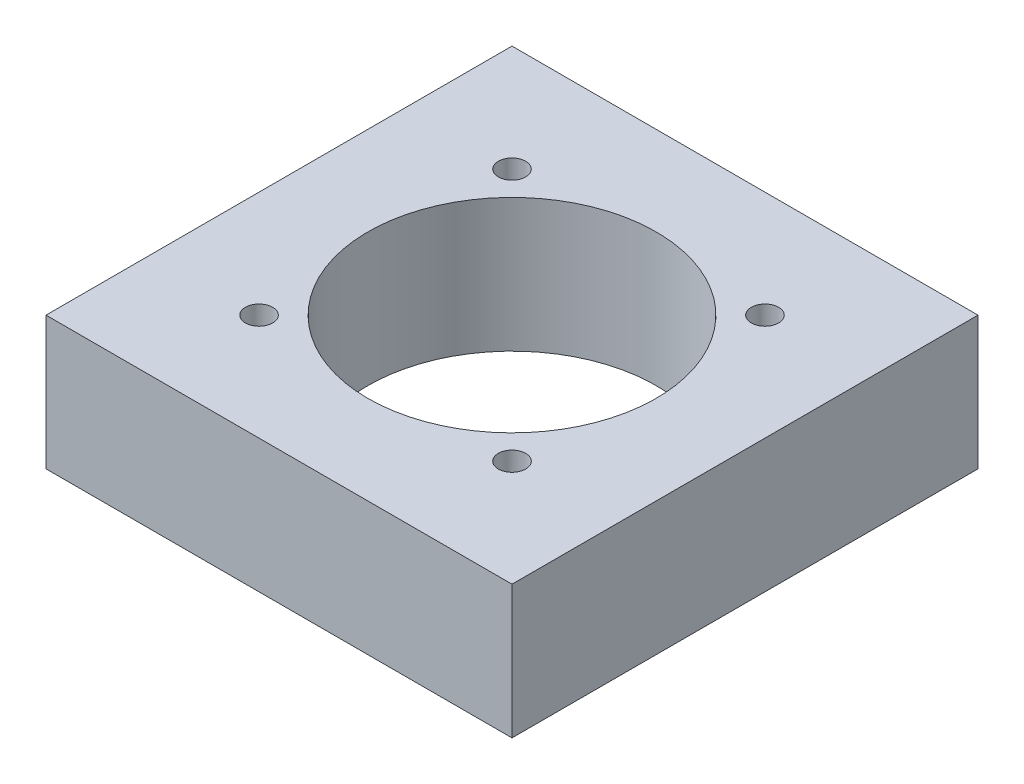
from build123d import *

# Parameters (mm, degrees)
SKETCH2_W           = 70
SKETCH2_H           = 70
BOSS_EXTRUDE1_DEPTH = 20
SKETCH3_R           = 2.05
CUT_EXTRUDE1_DEPTH  = 5
SKETCH4_R           = 21.658851084
CUT_EXTRUDE2_DEPTH  = 54.38539126


with BuildPart() as part:
    # Sketch2 → Boss-Extrude1 (new body)
    with BuildSketch(Plane(origin=(0, 0, 0), x_dir=(1, 0, 0), z_dir=(0, 1, 0))):
        Rectangle(SKETCH2_W, SKETCH2_H)
    extrude(amount=-BOSS_EXTRUDE1_DEPTH)

    # Sketch1 → Cut-Revolve1 (revolve, cut)
    with BuildSketch(Plane.XY):
        with BuildLine():
            Line((0, -17.2), (0, 0))
            Line((0, 0), (21.241684944, 0))
            Line((21.241684944, 0), (21.158851084, -0.511526958))
            add(Edge.make_bspline(
                [(0, -17.2), (0.530678283, -17.2), (1.61157482, -17.183508716), (3.615531125, -17.08588663), (5.944127269, -16.844919371), (8.44843367, -16.370131279), (11.442656399, -15.492934033), (14.579654851, -13.93724298), (17.382164488, -11.402739011), (19.199009229, -8.500896664), (20.23569058, -5.583194157), (20.706490619, -3.313387562), (20.981886079, -1.635929169), (21.096876841, -0.894238762), (21.158851084, -0.511526958)],
                knots=[0, 0, 0, 0, 0.03125, 0.0625, 0.125, 0.1875, 0.25, 0.375, 0.5, 0.625, 0.75, 0.875, 0.9375, 1, 1, 1, 1], degree=3))
        make_face()
    revolve(axis=Axis((0, -17.2, 0), (0, 1, 0)), mode=Mode.SUBTRACT)

    # Sketch3 → Cut-Extrude1 (cut)
    with BuildSketch(Plane(origin=(0, 0, 0), x_dir=(1, 0, 0), z_dir=(0, 1, 0))):
        with Locations((-19, 19)):
            Circle(SKETCH3_R)
        with Locations((19, -19)):
            Circle(SKETCH3_R)
        with Locations((-19, -19)):
            Circle(SKETCH3_R)
        with Locations((19, 19)):
            Circle(SKETCH3_R)
    extrude(amount=-CUT_EXTRUDE1_DEPTH, mode=Mode.SUBTRACT)

    # Sketch4 → Cut-Extrude2 (cut, through all)
    with BuildSketch(Plane(origin=(0, 0, 0), x_dir=(1, 0, 0), z_dir=(0, 1, 0))):
        Circle(SKETCH4_R)
    extrude(amount=-CUT_EXTRUDE2_DEPTH, mode=Mode.SUBTRACT)


solid = part.part
